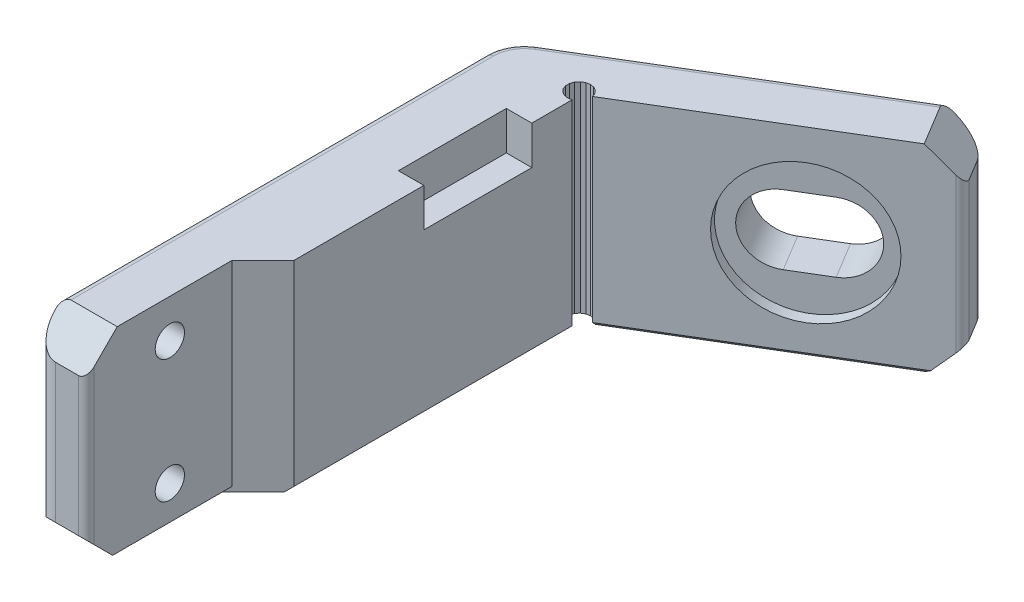
from build123d import *

# Parameters (mm, degrees)
LEG_AND_PAD_DEPTH          = 13
SCREW_HEAD_RELIEF_SKETCH_W = 14
SCREW_HEAD_RELIEF_SKETCH_H = 6
SCREW_HEAD_RELIEF_DEPTH    = 2.35
M6_SLOT_MIDDLE_DEPTH       = 4.5
SCREW_HOLES_SKETCH_R       = 1.9
SCREW_HOLES_DEPTH          = 4.5
LEG_TOP_CORNERS_SIZE       = 4
PAD_END_CORNERS_SIZE       = 4
OUTSIDE_OF_THE_BEND_R      = 5
LEG_TOP_OUTER_EDGE_R       = 3
PAD_END_OUTER_EDGE_R       = 3
LEG_TOP_INNER_EDGE_R       = 1
PAD_END_INNER_EDGE_R       = 1
BED_FACE_CHAMFER_SIZE      = 0.6
TOP_FACE_EDGE_R            = 1


with BuildPart() as part:
    # leg and pad sketch → leg and pad (new, symmetric)
    with BuildSketch(Plane(origin=(0, -20.7, 0), x_dir=(1, 0, 0), z_dir=(0, 1, 0))):
        Polygon((0.551289683, 30.332713936), (0.367250577, 30.819395741), (0.028023026, 31.213926146), (-0.425575667, 31.468833575), (-0.938966578, 31.553446481), (-1.450376329, 31.457583879), (-1.898269923, 31.192780366), (-2.228754897, 30.790898227), (-2.402065893, 30.30029363), (-2.397349395, 29.779998208), (-2.215172912, 29.292616119), (-1.877456693, 28.896791249), (-1.424836191, 28.640150931), (-0.91177263, 28.55357522), (-0.4, 28.647481273), (-0.4, -7.48), (-4.42, -11.5), (-4.42, -30.37), (-11.42, -30.37), (-11.42, 31.283844582), (27.204821487, 54.594667874), (30.821788068, 48.601542416), align=None)
    extrude(amount=LEG_AND_PAD_DEPTH, both=True)

    # screw head relief sketch → screw head relief (cut, symmetric)
    with BuildSketch(Plane(origin=(-1.35, 0, 0), x_dir=(0, 0, -1), z_dir=(1, 0, 0))):
        with Locations((16.4, -9.7)):
            Rectangle(SCREW_HEAD_RELIEF_SKETCH_W, SCREW_HEAD_RELIEF_SKETCH_H)
    extrude(amount=SCREW_HEAD_RELIEF_DEPTH, both=True, mode=Mode.SUBTRACT)

    # insert flange relief sketch → insert flange relief (revolve, cut)
    with BuildSketch(Plane(origin=(0, -20.7, 0), x_dir=(1, 0, 0), z_dir=(0, 1, 0))):
        Polygon((18.324853729, 39.891397061), (17.03307995, 42.03179901), (9.327632933, 37.381413406), (10.619406712, 35.241011457), align=None)
    revolve(axis=Axis((18.324853729, -20.7, -39.891397061), (-0.5167095115681243, 0, -0.8561607796757748)), mode=Mode.SUBTRACT)

    # M6 slot end 1 sketch → M6 slot end 1 (revolve, cut)
    with BuildSketch(Plane(origin=(0, -20.7, 0), x_dir=(1, 0, 0), z_dir=(0, 1, 0))):
        Polygon((20.465255678, 41.18317084), (15.814870074, 48.888617857), (11.962146565, 46.563425055), (16.612532169, 38.857978038), align=None)
    revolve(axis=Axis((20.465255678, -20.7, -41.18317084), (-0.5167095115681236, 0, -0.8561607796757752)), mode=Mode.SUBTRACT)

    # M6 slot end 2 sketch → M6 slot end 2 (revolve, cut)
    with BuildSketch(Plane(origin=(0, -20.7, 0), x_dir=(1, 0, 0), z_dir=(0, 1, 0))):
        Polygon((16.18445178, 38.599623282), (11.534066176, 46.305070299), (7.681342667, 43.979877497), (12.331728271, 36.27443048), align=None)
    revolve(axis=Axis((16.18445178, -20.7, -38.599623282), (-0.5167095115681234, 0, -0.8561607796757752)), mode=Mode.SUBTRACT)

    # M6 slot middle sketch → M6 slot middle (cut, symmetric)
    with BuildSketch(Plane(origin=(0, -20.7, 0), x_dir=(1, 0, 0), z_dir=(0, 1, 0))):
        Polygon((16.18445178, 38.599623282), (20.465255678, 41.18317084), (15.814870074, 48.888617857), (11.534066176, 46.305070299), align=None)
    extrude(amount=M6_SLOT_MIDDLE_DEPTH, both=True, mode=Mode.SUBTRACT)

    # screw holes sketch → screw holes (cut, symmetric)
    with BuildSketch(Plane(origin=(-7.92, 0, 0), x_dir=(0, 0, -1), z_dir=(1, 0, 0))):
        with Locations((-19.54, -28.7)):
            Circle(SCREW_HOLES_SKETCH_R)
        with Locations((-19.54, -12.7)):
            Circle(SCREW_HOLES_SKETCH_R)
    extrude(amount=SCREW_HOLES_DEPTH, both=True, mode=Mode.SUBTRACT)

    # leg top corners
    leg_top_corners_edges = [part.edges().sort_by_distance(p)[0] for p in [
        (-7.92, -7.7, 30.37),
        (-7.92, -33.7, 30.37),
    ]]
    chamfer(leg_top_corners_edges, length=LEG_TOP_CORNERS_SIZE)

    # pad end corners
    pad_end_corners_edges = [part.edges().sort_by_distance(p)[0] for p in [
        (29.013304778, -7.7, -51.598105145),
        (29.013304778, -33.7, -51.598105145),
    ]]
    chamfer(pad_end_corners_edges, length=PAD_END_CORNERS_SIZE)

    # outside of the bend
    outside_of_the_bend_edges = [part.edges().sort_by_distance(p)[0] for p in [
        (-11.42, -20.7, -31.283844582),
    ]]
    fillet(outside_of_the_bend_edges, radius=OUTSIDE_OF_THE_BEND_R)

    # leg top outer edge
    leg_top_outer_edge_edges = [part.edges().sort_by_distance(p)[0] for p in [
        (-11.42, -20.7, 30.37),
    ]]
    fillet(leg_top_outer_edge_edges, radius=LEG_TOP_OUTER_EDGE_R)

    # pad end outer edge
    pad_end_outer_edge_edges = [part.edges().sort_by_distance(p)[0] for p in [
        (27.204821487, -20.7, -54.594667874),
    ]]
    fillet(pad_end_outer_edge_edges, radius=PAD_END_OUTER_EDGE_R)

    # leg top inner edge
    leg_top_inner_edge_edges = [part.edges().sort_by_distance(p)[0] for p in [
        (-4.42, -20.7, 30.37),
    ]]
    fillet(leg_top_inner_edge_edges, radius=LEG_TOP_INNER_EDGE_R)

    # pad end inner edge
    pad_end_inner_edge_edges = [part.edges().sort_by_distance(p)[0] for p in [
        (30.821788068, -20.7, -48.601542416),
    ]]
    fillet(pad_end_inner_edge_edges, radius=PAD_END_INNER_EDGE_R)

    # bed face chamfer
    bed_face_chamfer_edges = [part.edges().sort_by_distance(p)[0] for p in [
        (13.974217317, -33.7, -38.433709153),
        (7.388315405, -33.7, -42.635024987),
        (-4.42, -33.7, 18.935),
        (-0.4, -33.7, -10.583740636),
        (-10.774178326, -33.7, -30.919287503),
        (-11.42, -33.7, -1.045708124),
    ]]
    chamfer(bed_face_chamfer_edges, length=BED_FACE_CHAMFER_SIZE)

    # top face edge
    top_face_edge_edges = [part.edges().sort_by_distance(p)[0] for p in [
        (7.388315405, -7.7, -42.635024987),
        (-10.774178326, -7.7, -30.919287503),
        (-11.42, -7.7, -1.045708124),
    ]]
    fillet(top_face_edge_edges, radius=TOP_FACE_EDGE_R)


solid = part.part
